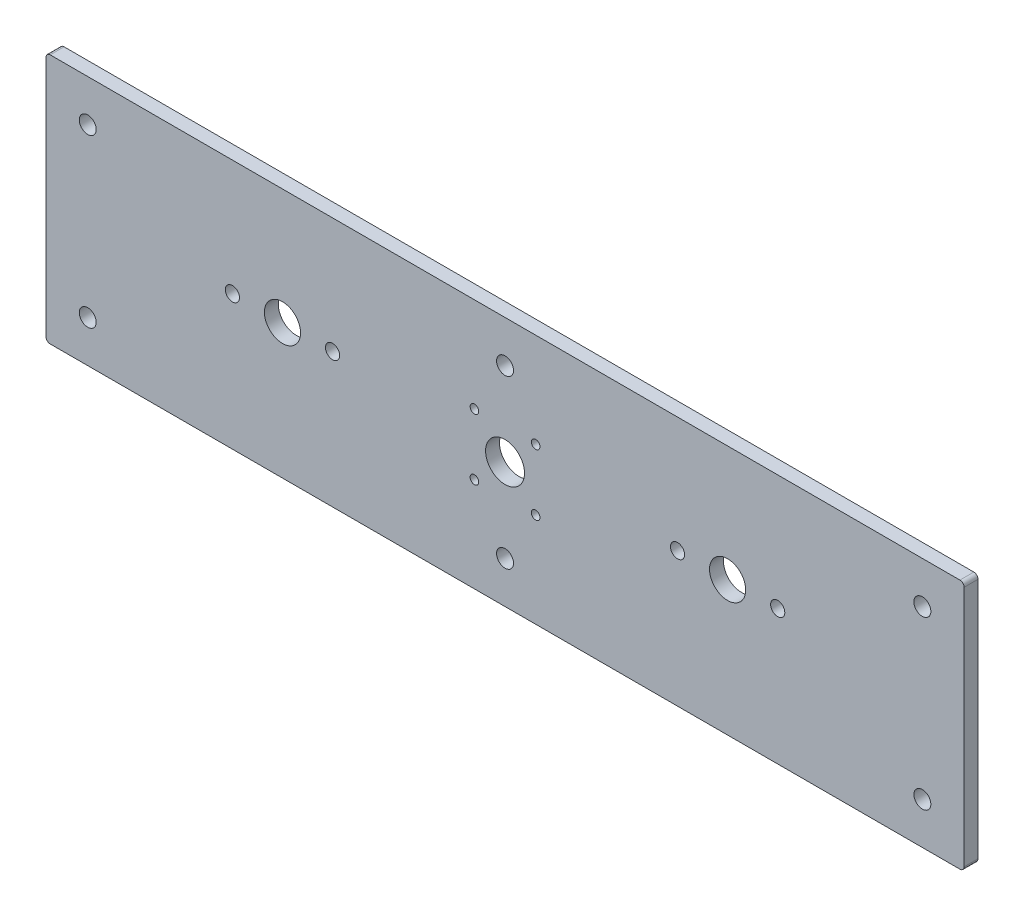
from build123d import *

# Parameters (mm, degrees)
SKETCH1_W           = 330
SKETCH1_H           = 90
BOSS_EXTRUDE1_DEPTH = 2.5
SKETCH2_R           = 3.05
CUT_EXTRUDE1_DEPTH  = 172.099386323
SKETCH3_R           = 6.5
SKETCH3_R_2         = 2.55
CUT_EXTRUDE2_DEPTH  = 172.099386323
SKETCH4_R           = 1.55
SKETCH4_R_2         = 7
CUT_EXTRUDE3_DEPTH  = 172.099386323
FILLET1_R           = 1.5


with BuildPart() as part:
    # Sketch1 → Boss-Extrude1 (new, symmetric)
    with BuildSketch(Plane.XY):
        Rectangle(SKETCH1_W, SKETCH1_H)
    extrude(amount=BOSS_EXTRUDE1_DEPTH, both=True)

    # Sketch2 → Cut-Extrude1 (cut, through all)
    with BuildSketch(Plane.XY.offset(2.5)):
        with Locations((150, 30)):
            Circle(SKETCH2_R)
        with Locations((150, -30)):
            Circle(SKETCH2_R)
        with Locations((0, 30)):
            Circle(SKETCH2_R)
        with Locations((0, -30)):
            Circle(SKETCH2_R)
        with Locations((-150, -30)):
            Circle(SKETCH2_R)
        with Locations((-150, 30)):
            Circle(SKETCH2_R)
    extrude(amount=-CUT_EXTRUDE1_DEPTH, mode=Mode.SUBTRACT)

    # Sketch3 → Cut-Extrude2 (cut, through all)
    with BuildSketch(Plane.XY.offset(2.5)):
        with Locations((-80, 3.4)):
            Circle(SKETCH3_R)
        with Locations((-62, 3.4)):
            Circle(SKETCH3_R_2)
        with Locations((-98, 3.4)):
            Circle(SKETCH3_R_2)
    cut_extrude2 = extrude(amount=-CUT_EXTRUDE2_DEPTH, mode=Mode.SUBTRACT)

    # Mirror1: Cut-Extrude2 across plane
    add(cut_extrude2.mirror(Plane(origin=(0, 0, 0), x_dir=(0, 0, 1), z_dir=(1, 0, 0))), mode=Mode.SUBTRACT)

    # Sketch4 → Cut-Extrude3 (cut, through all)
    with BuildSketch(Plane.XY.offset(2.5)):
        with Locations((11, 11)):
            Circle(SKETCH4_R)
        with Locations((11, -11)):
            Circle(SKETCH4_R)
        with Locations((-11, -11)):
            Circle(SKETCH4_R)
        with Locations((-11, 11)):
            Circle(SKETCH4_R)
        Circle(SKETCH4_R_2)
    extrude(amount=-CUT_EXTRUDE3_DEPTH, mode=Mode.SUBTRACT)

    # Fillet1
    fillet1_edges = [part.edges().sort_by_distance(p)[0] for p in [
        (-165, -45, 0),
        (-165, 45, 0),
        (165, -45, 0),
        (165, 45, 0),
    ]]
    fillet(fillet1_edges, radius=FILLET1_R)


solid = part.part
